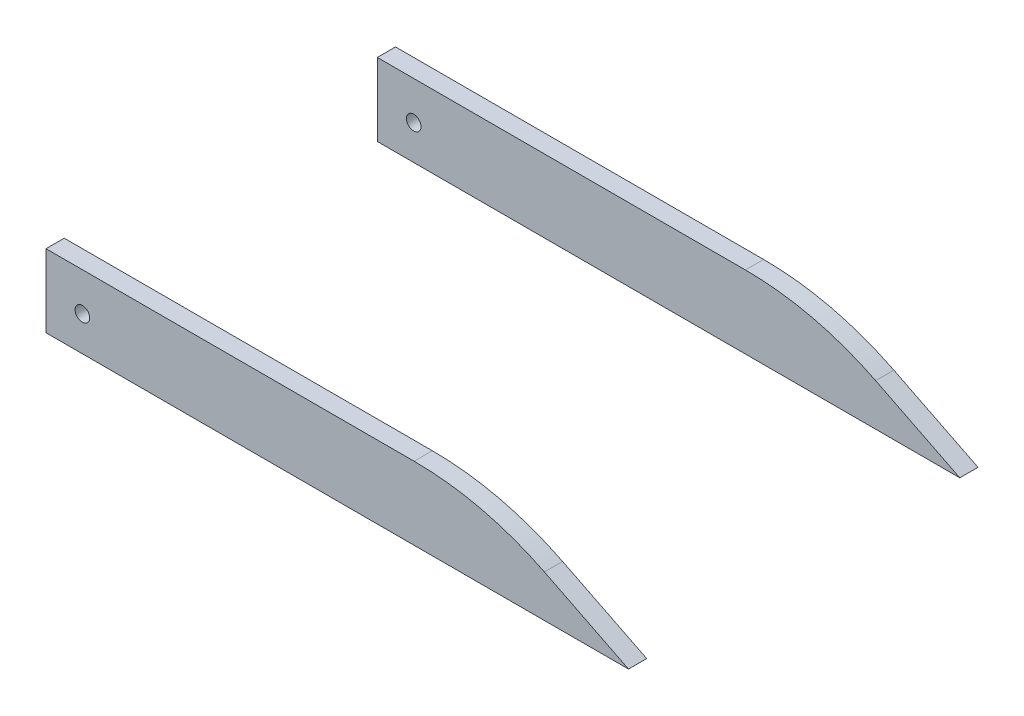
from build123d import *

# Parameters (mm, degrees)
BOSS_EXTRUDE1_START     = 91
BOSS_EXTRUDE1_DEPTH     = 5
BOSS_EXTRUDE2_DEPTH     = 5
CUT_EXTRUDE1_DEPTH      = 186.151289491
CUT_EXTRUDE1_DEPTH_BACK = 186.151289491
SKETCH3_R               = 2


with BuildPart() as part:
    # Sketch2 → Boss-Extrude1 (new body)
    with BuildSketch(Plane.XY.offset(BOSS_EXTRUDE1_START)):
        with BuildLine():
            Line((0, 0), (0, -20))
            Line((0, -20), (160, -20))
            Line((160, -20), (136.89164944, -8.44582472))
            ThreePointArc((136.89164944, -8.44582472), (119.494795444, -2.140080843), (101.1145618, 0))
            Line((101.1145618, 0), (0, 0))
        make_face()
    extrude(amount=BOSS_EXTRUDE1_DEPTH)


with BuildPart() as body_2:
    # Sketch2<2> → Boss-Extrude2 (new body)
    with BuildSketch(Plane.XY):
        with BuildLine():
            Line((0, 0), (0, -20))
            Line((0, -20), (160, -20))
            Line((160, -20), (136.89164944, -8.44582472))
            ThreePointArc((136.89164944, -8.44582472), (119.494795444, -2.140080843), (101.1145618, 0))
            Line((101.1145618, 0), (0, 0))
        make_face()
    extrude(amount=BOSS_EXTRUDE2_DEPTH)


with BuildPart() as cut_extrude1_tool:
    # Sketch3 → Cut-Extrude1 (new, two sides: drawn at the far end of the back side and taken through both)
    with BuildSketch(Plane.XY.offset(5).offset(-CUT_EXTRUDE1_DEPTH_BACK)):
        with Locations((10, -10.5)):
            Circle(SKETCH3_R)
    extrude(amount=CUT_EXTRUDE1_DEPTH + CUT_EXTRUDE1_DEPTH_BACK)


with BuildPart() as part_1:
    add(part.part)

    # Cut-Extrude1: cut by cut_extrude1_tool
    add(cut_extrude1_tool.part, mode=Mode.SUBTRACT)


with BuildPart() as body_2_1:
    add(body_2.part)

    # Cut-Extrude1: cut by cut_extrude1_tool
    add(cut_extrude1_tool.part, mode=Mode.SUBTRACT)


solid = Compound([part_1.part, body_2_1.part])
